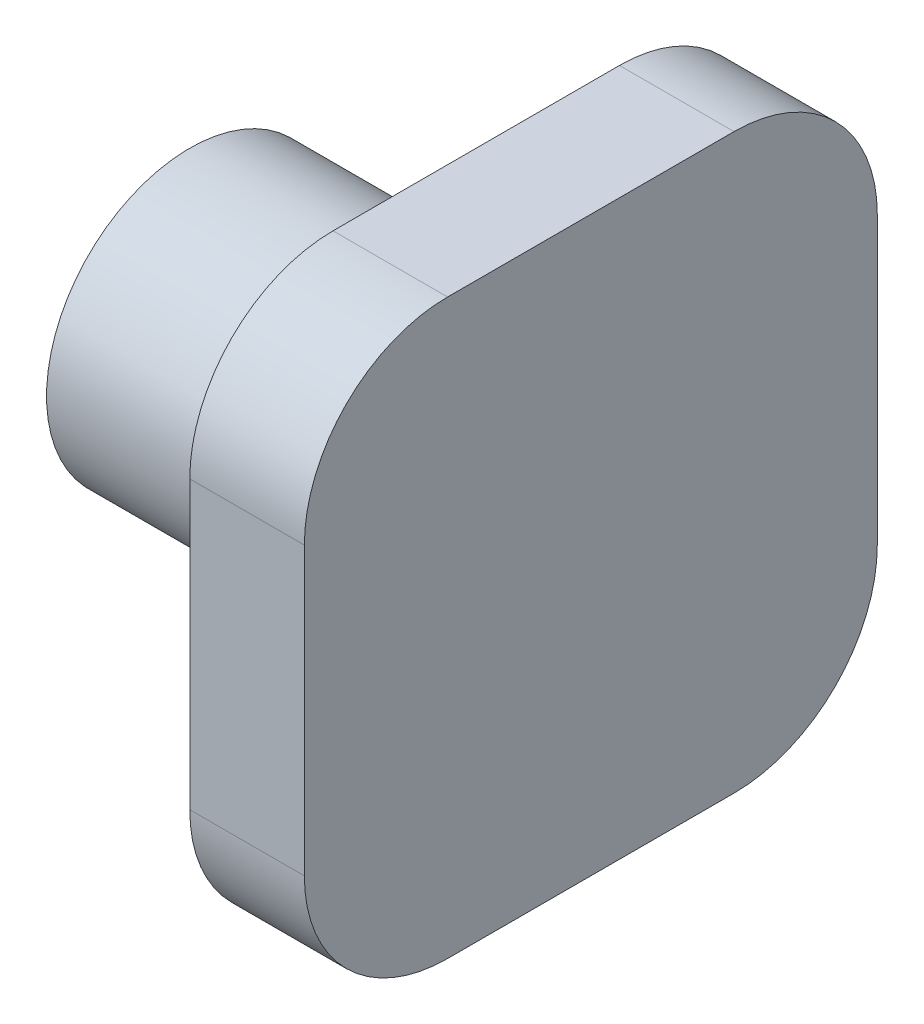
from build123d import *

# Parameters (mm, degrees)
SKETCH1_R           = 6.35
SKETCH1_R_2         = 4.445
BOSS_EXTRUDE1_DEPTH = 12.7
THREAD1_PITCH       = 2.54
BOSS_EXTRUDE2_DEPTH = 5.08


with BuildPart() as part:
    # Sketch1 → Boss-Extrude1 (new body)
    with BuildSketch(Plane(origin=(0, 0, 0), x_dir=(0, 0, -1), z_dir=(1, 0, 0))):
        Circle(SKETCH1_R)
        Circle(SKETCH1_R_2, mode=Mode.SUBTRACT)
    extrude(amount=BOSS_EXTRUDE1_DEPTH)

    # Thread1: the profile of Thread Profile1 profile screwed along a left-hand helix of 5 turns, 10 arcs to a turn; built about Z, then put on its axis
    thread1_z = Axis((0, 0, 0), (0, 0, 1))
    thread1_corners = [(4.4456, 0, -0.00034641), (4.4456, 0, 2.222846403), (3.070184677, 0, 1.428749997), (3.070184677, 0, 0.793749997)]
    with BuildLine(mode=Mode.PRIVATE) as thread1_profile:
        Line(thread1_corners[0], thread1_corners[1])
        Line(thread1_corners[1], thread1_corners[2])
        Line(thread1_corners[2], thread1_corners[3])
        Line(thread1_corners[3], thread1_corners[0])
    thread1_cap = Face(thread1_profile.wire())
    thread1_turn_angles = [0, -18, -36, -54, -72, -90, -108, -126, -144, -162, -180, -198, -216, -234, -252, -270, -288, -306, -324, -342, -360]
    thread1_turn_weights = [1, 0.9510565162951535, 1, 0.9510565162951535, 1, 0.9510565162951535, 1, 0.9510565162951535, 1, 0.9510565162951535, 1, 0.9510565162951535, 1, 0.9510565162951535, 1, 0.9510565162951535, 1, 0.9510565162951535, 1, 0.9510565162951535, 1]
    thread1_turn_rails = [Edge.make_bspline([Vector(p[0], p[1], 0).rotate(thread1_z, thread1_turn_angles[k]) / thread1_turn_weights[k] + Vector(0, 0, p[2] + -THREAD1_PITCH * thread1_turn_angles[k] / 360) for k in range(21)], [0, 0, 0, 1, 1, 2, 2, 3, 3, 4, 4, 5, 5, 6, 6, 7, 7, 8, 8, 9, 9, 10, 10, 10], 2, thread1_turn_weights) for p in thread1_corners]
    thread1_turn_sides = [Face.make_surface_from_curves(thread1_turn_rails[p[0]], thread1_turn_rails[p[1]]) for p in [(0, 1), (1, 2), (2, 3), (3, 0)]]
    thread1 = Plane(origin=(0, 0, 0), x_dir=(0, 0, -1), z_dir=(1, 0, 0)) * Solid(Shell([*[p.moved(Location((0, 0, THREAD1_PITCH * i))) for i in range(5) for p in thread1_turn_sides], thread1_cap, thread1_cap.rotate(thread1_z, -1800).moved(Location((0, 0, -THREAD1_PITCH * -1800 / 360)))]))
    add(thread1)

    # Sketch4 → Boss-Extrude2 (add)
    with BuildSketch(Plane(origin=(12.7, 0, 0), x_dir=(0, 0, -1), z_dir=(1, 0, 0))):
        with BuildLine():
            Line((-6.35, 12.7), (6.35, 12.7))
            ThreePointArc((6.35, 12.7), (10.840128061, 10.840128061), (12.7, 6.35))
            Line((12.7, 6.35), (12.7, -6.35))
            ThreePointArc((12.7, -6.35), (10.840128061, -10.840128061), (6.35, -12.7))
            Line((6.35, -12.7), (-6.35, -12.7))
            ThreePointArc((-6.35, -12.7), (-10.840128061, -10.840128061), (-12.7, -6.35))
            Line((-12.7, -6.35), (-12.7, 6.35))
            ThreePointArc((-12.7, 6.35), (-10.840128061, 10.840128061), (-6.35, 12.7))
        make_face()
    extrude(amount=BOSS_EXTRUDE2_DEPTH)


solid = part.part
